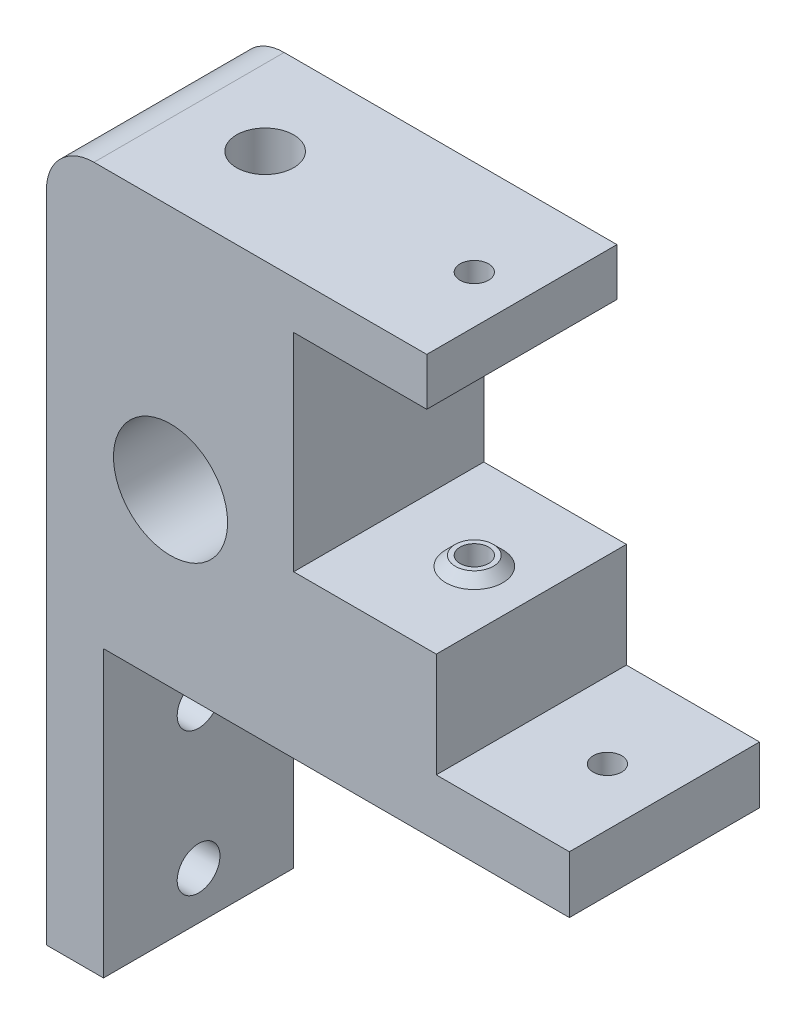
from build123d import *

# Parameters (mm, degrees)
SKETCH1_R               = 6
BOSS_EXTRUDE1_DEPTH     = 20
SKETCH2_R               = 2.25
CUT_EXTRUDE1_DEPTH      = 20
SKETCH4_R               = 1.5
CUT_EXTRUDE2_DEPTH      = 45
BOSS_EXTRUDE2_START     = 11
SKETCH5_W               = 15.288681569
SKETCH5_H               = 20
SKETCH5_R               = 1.5
BOSS_EXTRUDE2_DEPTH     = 11
CUT_EXTRUDE3_REACH      = 89.238
CUT_EXTRUDE3_END_RADIUS = 6
SKETCH6_R               = 1.25
SKETCH7_R               = 3
CUT_EXTRUDE4_DEPTH      = 5
CUT_EXTRUDE5_DEPTH      = 5
FILLET1_R               = 5
BOSS_EXTRUDE3_START     = 1
SKETCH10_R              = 3
SKETCH10_R_2            = 1.5
BOSS_EXTRUDE3_DEPTH     = 1
CHAMFER1_SIZE           = 1
SKETCH11_R              = 3
SKETCH11_R_2            = 1.5
BOSS_EXTRUDE4_DEPTH     = 1
CHAMFER2_SIZE           = 1


with BuildPart() as part:
    # Sketch1 → Boss-Extrude1 (new body)
    with BuildSketch(Plane.XY):
        Polygon((27, 30.8), (27, 25.8), (13, 25.8), (13, -7), (42, -7), (42, -13), (-7, -13), (-7, -43), (-13, -43), (-13, -8.291544952), (-13, 30.8), align=None)
        with Locations((0.051684878, 5)):
            Circle(SKETCH1_R, mode=Mode.SUBTRACT)
    extrude(amount=BOSS_EXTRUDE1_DEPTH)

    # Sketch2 → Cut-Extrude1 (cut)
    with BuildSketch(Plane.ZY.offset(13)):
        with Locations(Location((10, -38, 0), (0, 0, 270))):
            Circle(SKETCH2_R)
        with Locations(Location((10, -23, 0), (0, 0, 270))):
            Circle(SKETCH2_R)
    extrude(amount=-CUT_EXTRUDE1_DEPTH, mode=Mode.SUBTRACT)

    # Sketch4 → Cut-Extrude2 (cut)
    with BuildSketch(Plane(origin=(0, 30.8, 0), x_dir=(1, 0, 0), z_dir=(0, 1, 0))):
        with Locations(Location((22, -10, 0), (0, 0, 180))):
            Circle(SKETCH4_R)
        with Locations(Location((36, -10, 0), (0, 0, 180))):
            Circle(SKETCH4_R)
    extrude(amount=-CUT_EXTRUDE2_DEPTH, mode=Mode.SUBTRACT)

    # Sketch5 → Boss-Extrude2 (add)
    with BuildSketch(Plane(origin=(0, -7, 0), x_dir=(1, 0, 0), z_dir=(0, 1, 0)).offset(BOSS_EXTRUDE2_START)):
        with Locations((20.355659216, -10)):
            Rectangle(SKETCH5_W, SKETCH5_H)
        with Locations(Location((22, -10, 0), (0, 0, 180))):
            Circle(SKETCH5_R, mode=Mode.SUBTRACT)
    extrude(amount=-BOSS_EXTRUDE2_DEPTH)

    # Cut-Extrude3: up to this cylinder (the profile starts outside it)
    cut_extrude3_end = Plane(origin=(0.051684878, 5, 10), z_dir=(0, 0, -1)) * Cylinder(CUT_EXTRUDE3_END_RADIUS, 191.476, mode=Mode.PRIVATE)
    # Sketch6 → Cut-Extrude3 (cut, up to the surface)
    with BuildSketch(Plane(origin=(0, 30.8, 0), x_dir=(1, 0, 0), z_dir=(0, 1, 0)), mode=Mode.PRIVATE) as cut_extrude3_sk1:
        with Locations(Location((0, -10, 0), (0, 0, 180))):
            Circle(SKETCH6_R)
    cut_extrude3_tool1 = extrude(cut_extrude3_sk1.sketch, amount=-CUT_EXTRUDE3_REACH, mode=Mode.PRIVATE) - cut_extrude3_end
    add(cut_extrude3_tool1.solids().sort_by_distance((0, 30.8, 10))[0], mode=Mode.SUBTRACT)

    # Sketch7 → Cut-Extrude4 (cut)
    with BuildSketch(Plane(origin=(0, 30.8, 0), x_dir=(1, 0, 0), z_dir=(0, 1, 0))):
        with Locations(Location((0, -10, 0), (0, 0, 180))):
            Circle(SKETCH7_R)
    extrude(amount=-CUT_EXTRUDE4_DEPTH, mode=Mode.SUBTRACT)

    # Sketch9 → Cut-Extrude5 (cut)
    with BuildSketch(Plane.XZ.offset(13)):
        Polygon((25.233161507, 10), (23.616580754, 12.8), (20.383419246, 12.8), (18.766838493, 10), (20.383419246, 7.2), (23.616580754, 7.2), align=None)
    extrude(amount=-CUT_EXTRUDE5_DEPTH, mode=Mode.SUBTRACT)

    # Fillet1
    fillet1_edges = [part.edges().sort_by_distance(p)[0] for p in [
        (-13, 30.8, 10),
    ]]
    fillet(fillet1_edges, radius=FILLET1_R)

    # Sketch10 → Boss-Extrude3 (add)
    with BuildSketch(Plane(origin=(0, 4, 0), x_dir=(1, 0, 0), z_dir=(0, 1, 0)).offset(BOSS_EXTRUDE3_START)):
        with Locations(Location((22, -10, 0), (0, 0, 180))):
            Circle(SKETCH10_R)
        with Locations(Location((22, -10, 0), (0, 0, 180))):
            Circle(SKETCH10_R_2, mode=Mode.SUBTRACT)
    extrude(amount=-BOSS_EXTRUDE3_DEPTH)

    # Chamfer1
    chamfer1_edges = [part.edges().sort_by_distance(p)[0] for p in [
        (25, 5, 10),
    ]]
    chamfer(chamfer1_edges, length=CHAMFER1_SIZE - 0.0001)  # a hair under: the kernel refuses the full size

    # Sketch11 → Boss-Extrude4 (add)
    with BuildSketch(Plane.XZ.offset(-25.8)):
        with Locations(Location((22, 10, 0), (0, 0, 180))):
            Circle(SKETCH11_R)
        with Locations(Location((22, 10, 0), (0, 0, 180))):
            Circle(SKETCH11_R_2, mode=Mode.SUBTRACT)
    extrude(amount=BOSS_EXTRUDE4_DEPTH)

    # Chamfer2
    chamfer2_edges = [part.edges().sort_by_distance(p)[0] for p in [
        (25, 24.8, 10),
    ]]
    chamfer(chamfer2_edges, length=CHAMFER2_SIZE - 0.0001)  # a hair under: the kernel refuses the full size


solid = part.part
